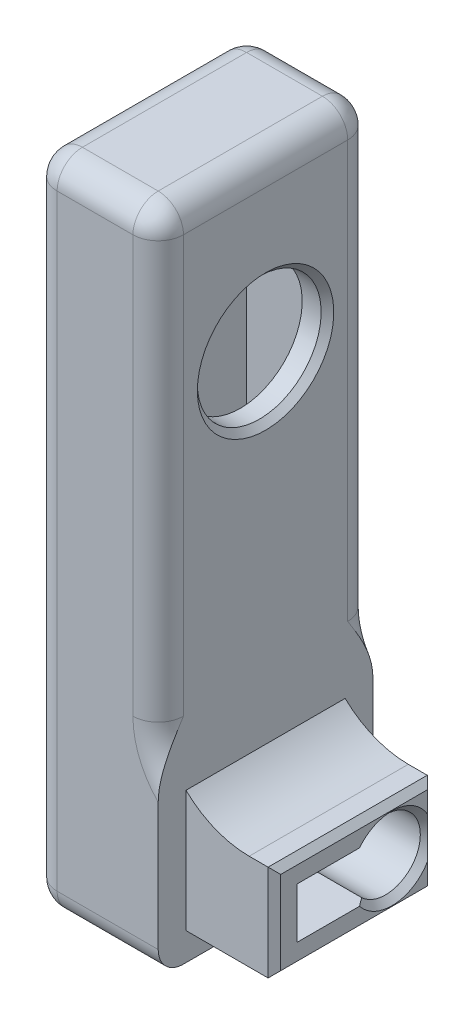
from build123d import *

# Parameters (mm, degrees)
SKETCH1_W                = 13
SKETCH1_H                = 8
BOSS_EXTRUDE1_DEPTH      = 7
BOSS_EXTRUDE2_DEPTH      = 2
BOSS_EXTRUDE2_DEPTH_BACK = 50
SKETCH2_W                = 10
SKETCH2_H                = 17
BOSS_EXTRUDE3_REACH      = 56.9
SKETCH3_W                = 17
SKETCH3_H                = 2
FILLET4_R                = 5
FILLET3_R                = 2
SKETCH4_W                = 17
SKETCH4_H                = 7
CUT_EXTRUDE1_DEPTH       = 7
BOSS_EXTRUDE4_DEPTH      = 13
SHELL1_START             = -13
SHELL1_OUTLINE_W         = 6
SHELL1_OUTLINE_H         = 48
SHELL1_DEPTH             = 13
SHELL1_START_2           = -11
SHELL1_2_DEPTH           = 9
CUT_EXTRUDE2_REACH       = 55.151
SKETCH6_R                = 4.9
CHAMFER1_SIZE            = 0.5
CUT_EXTRUDE3_REACH       = 56.9
SKETCH7_R                = 2.75
SKETCH8_R                = 1.75
CUT_EXTRUDE4_DEPTH       = 55.899908953
CUT_EXTRUDE5_REACH       = 56.9
CUT_EXTRUDE6_START       = -12.6
CUT_EXTRUDE6_DEPTH       = 12.6
CHAMFER2_SIZE            = 0.5


# Read off the part's stored shape, not the designer's step: Shell1
# Some blends are built 0.0001 mm under size
with BuildPart() as part:
    # Sketch1 → Boss-Extrude1 (new body)
    with BuildSketch(Plane(origin=(0, 0, 0), x_dir=(0, 0, -1), z_dir=(1, 0, 0))):
        with Locations((6.5, 4)):
            Rectangle(SKETCH1_W, SKETCH1_H)
    extrude(amount=BOSS_EXTRUDE1_DEPTH)

    # Sketch2 → Boss-Extrude2 (add, two sides: drawn at the far end of the back side and taken through both)
    with BuildSketch(Plane(origin=(0, 0, 0), x_dir=(-1, 0, 0), z_dir=(0, -1, 0)).offset(-BOSS_EXTRUDE2_DEPTH_BACK)):
        with Locations((5, 6.5)):
            Rectangle(SKETCH2_W, SKETCH2_H)
    extrude(amount=BOSS_EXTRUDE2_DEPTH + BOSS_EXTRUDE2_DEPTH_BACK)

    # Sketch3 → Boss-Extrude3 (add, up to next)
    with BuildSketch(Plane(origin=(7, 0, 0), x_dir=(0, 0, -1), z_dir=(1, 0, 0)), mode=Mode.PRIVATE) as boss_extrude3_sk1:
        with Locations((6.5, 9)):
            Rectangle(SKETCH3_W, SKETCH3_H)
    boss_extrude3_tool1 = extrude(boss_extrude3_sk1.sketch, amount=-BOSS_EXTRUDE3_REACH, mode=Mode.PRIVATE) - part.part
    add(boss_extrude3_tool1.solids().sort_by_distance((7, 9, -6.5))[0])

    # Fillet4
    fillet4_edges = [part.edges().sort_by_distance(p)[0] for p in [
        (0, 10, -6.5),
    ]]
    fillet(fillet4_edges, radius=FILLET4_R)

    # Fillet3
    fillet3_edges = [part.edges().sort_by_distance(p)[0] for p in [
        (-5, 50, -15),
        (-10, 50, -6.5),
        (-5, 50, 2),
        (0, 50, -6.5),
        (-10, 24, 2),
        (-5, -2, 2),
        (-10, 24, -15),
        (-10, -2, -6.5),
        (-5, -2, -15),
        (6, 10, -15),
        (1.464466094, 11.464466094, -15),
        (6, 10, 2),
        (1.464466094, 11.464466094, 2),
        (0, 32.5, -15),
        (0, 32.5, 2),
    ]]
    fillet(fillet3_edges, radius=FILLET3_R - 0.0001)  # a hair under: the kernel refuses the full size

    # Sketch4 → Cut-Extrude1 (cut)
    with BuildSketch(Plane(origin=(7, 0, 0), x_dir=(0, 0, -1), z_dir=(1, 0, 0))):
        with Locations((6.5, 11.5)):
            Rectangle(SKETCH4_W, SKETCH4_H)
    extrude(amount=-CUT_EXTRUDE1_DEPTH, mode=Mode.SUBTRACT)

    # Sketch5 → Boss-Extrude4 (add)
    with BuildSketch(Plane(origin=(0, 0, -13), x_dir=(-1, 0, 0), z_dir=(0, 0, -1))):
        with BuildLine():
            Line((0, 8), (-5, 8))
            ThreePointArc((-5, 8), (-2.288252998, 8.546595612), (0, 10.101020514))
            Line((0, 10.101020514), (0, 8))
        make_face()
    extrude(amount=-BOSS_EXTRUDE4_DEPTH)

    # Shell1 outline → Shell1 (cut)
    with BuildSketch(Plane.XY.offset(SHELL1_START)):
        with Locations((-5, 24)):
            Rectangle(SHELL1_OUTLINE_W, SHELL1_OUTLINE_H)
    extrude(amount=SHELL1_DEPTH, mode=Mode.SUBTRACT)

    # Shell1 2 outline → Shell1 2 (cut)
    with BuildSketch(Plane.XY.offset(SHELL1_START_2)):
        with BuildLine():
            Line((-2, 2), (7, 2))
            Line((7, 2), (7, 6))
            Line((7, 6), (5, 6))
            ThreePointArc((5, 6), (1.121320343, 6.878679656), (-2, 9.343145751))
            Line((-2, 9.343145751), (-2, 2))
        make_face()
    extrude(amount=SHELL1_2_DEPTH, mode=Mode.SUBTRACT)

    # Sketch6 → Cut-Extrude2 (cut, up to next)
    with BuildSketch(Plane(origin=(0, 0, 0), x_dir=(0, 0, -1), z_dir=(1, 0, 0)), mode=Mode.PRIVATE) as cut_extrude2_sk1:
        with Locations((6.5, 36.75)):
            Circle(SKETCH6_R)
    cut_extrude2_tool1 = extrude(cut_extrude2_sk1.sketch, amount=-CUT_EXTRUDE2_REACH, mode=Mode.PRIVATE) & part.part
    add(cut_extrude2_tool1.solids().sort_by_distance((0, 36.75, -6.5))[0], mode=Mode.SUBTRACT)

    # Chamfer1
    chamfer1_edges = [part.edges().sort_by_distance(p)[0] for p in [
        (0, 36.75, -1.6),
    ]]
    chamfer(chamfer1_edges, length=CHAMFER1_SIZE)

    # Cut-Extrude3: up to this face of the body (flat: up to its plane)
    cut_extrude3_end = Plane(part.part.faces().sort_by_distance((-8, 24, -6.5))[0])
    # Sketch7 → Cut-Extrude3 (cut, up to the picked face)
    with BuildSketch(Plane(origin=(7, 0, 0), x_dir=(0, 0, -1), z_dir=(1, 0, 0)), mode=Mode.PRIVATE) as cut_extrude3_sk1:
        with Locations((9.5, 4)):
            Circle(SKETCH7_R)
    cut_extrude3_tool1 = split(extrude(cut_extrude3_sk1.sketch, amount=-CUT_EXTRUDE3_REACH, mode=Mode.PRIVATE), bisect_by=cut_extrude3_end, keep=Keep.BOTH, mode=Mode.PRIVATE)
    add(cut_extrude3_tool1.solids().sort_by(Axis((7, 4, -9.5), (-1, 0, 0)))[0], mode=Mode.SUBTRACT)

    # Sketch8 → Cut-Extrude4 (cut, through all)
    with BuildSketch(Plane(origin=(7, 0, 0), x_dir=(0, 0, -1), z_dir=(1, 0, 0))):
        with Locations((9.5, 4)):
            Circle(SKETCH8_R)
    extrude(amount=-CUT_EXTRUDE4_DEPTH, mode=Mode.SUBTRACT)

    # Cut-Extrude5: up to this face of the body (flat: up to its plane)
    cut_extrude5_end = Plane(part.part.faces().sort_by_distance((0, 23.174375266, -6.49999999))[0])
    # Sketch9 → Cut-Extrude5 (cut, up to the picked face)
    with BuildSketch(Plane(origin=(7, 0, 0), x_dir=(0, 0, -1), z_dir=(1, 0, 0)), mode=Mode.PRIVATE) as cut_extrude5_sk1:
        Polygon((0, 10.101020514), (0.2, 10.101020514), (0.2, 0.2), (12.8, 0.2), (12.8, 10.101020514), (13, 10.101020514), (13, 0), (0, 0), align=None)
    cut_extrude5_tool1 = split(extrude(cut_extrude5_sk1.sketch, amount=-CUT_EXTRUDE5_REACH, mode=Mode.PRIVATE), bisect_by=cut_extrude5_end, keep=Keep.BOTH, mode=Mode.PRIVATE)
    add(cut_extrude5_tool1.solids().sort_by(Axis((7, 9.93639, -0.1), (-1, 0, 0)))[0], mode=Mode.SUBTRACT)

    # Sketch10 → Cut-Extrude6 (cut)
    with BuildSketch(Plane.XY.offset(-0.2).offset(CUT_EXTRUDE6_START)):
        with BuildLine():
            Line((7, 8), (5, 8))
            ThreePointArc((5, 8), (2.288252998, 8.546595612), (0, 10.101020514))
            Line((0, 10.101020514), (0, 9.819266461))
            ThreePointArc((0, 9.819266461), (2.303825069, 8.32387532), (5, 7.8))
            Line((5, 7.8), (7, 7.8))
            Line((7, 7.8), (7, 8))
        make_face()
    extrude(amount=CUT_EXTRUDE6_DEPTH, mode=Mode.SUBTRACT)

    # Chamfer2
    # the kernel refuses this chamfer: 0.5 mm, written as the material it takes off along each edge
    with BuildSketch(Plane(origin=(7, 4, -9.5), x_dir=(0, 0.33829869190957257, 0.9410387850945741), z_dir=(0, -0.9410387850945741, 0.33829869190957257))) as chamfer2_piece_1:
        Polygon((2.75 + CHAMFER2_SIZE, 0), (2.75, CHAMFER2_SIZE), (2.75, 0), align=None)
    revolve(axis=Axis((7, 4, -9.5), (-1, 0, 0)), revolution_arc=320.453489915, mode=Mode.SUBTRACT)
    with BuildSketch(Plane(origin=(7, 0.2, 1.085841494), x_dir=(-0.9996219169112968, -0.027495876610586403, 0), z_dir=(0, 0, -1))) as chamfer2_piece_2:
        Polygon((CHAMFER2_SIZE * 0.999621916911, CHAMFER2_SIZE * 0.0274958766106), (-CHAMFER2_SIZE * 0.0274958766106, CHAMFER2_SIZE * 0.999621916911), (0, 0), align=None)
    extrude(amount=15.171682988, mode=Mode.SUBTRACT)
    with BuildSketch(Plane(origin=(7, 9.085841494, -0.2), x_dir=(-0.9996219169112968, 0, 0.027495876610586403), z_dir=(0, -1, 0)), Plane(origin=(7, -1.085841494, -12.8), x_dir=(-0.9996219169112968, 0, -0.027495876610585647), z_dir=(0, 1, 0))) as chamfer2_piece_3:
        Polygon((CHAMFER2_SIZE * 0.999621916911, CHAMFER2_SIZE * 0.0274958766106), (-CHAMFER2_SIZE * 0.0274958766106, CHAMFER2_SIZE * 0.999621916911), (0, 0), align=None)
    extrude(amount=10.171682988, mode=Mode.SUBTRACT)
    with BuildSketch(Plane(origin=(7, 7.8, -14.085841494), x_dir=(0.027495876610585647, -0.9996219169112968, 0), z_dir=(0, 0, 1))) as chamfer2_piece_4:
        Polygon((CHAMFER2_SIZE * 0.999621916911, -CHAMFER2_SIZE * 0.0274958766106), (-CHAMFER2_SIZE * 0.0274958766106, -CHAMFER2_SIZE * 0.999621916911), (0, 0), align=None)
    extrude(amount=15.171682988, mode=Mode.SUBTRACT)


solid = part.part
